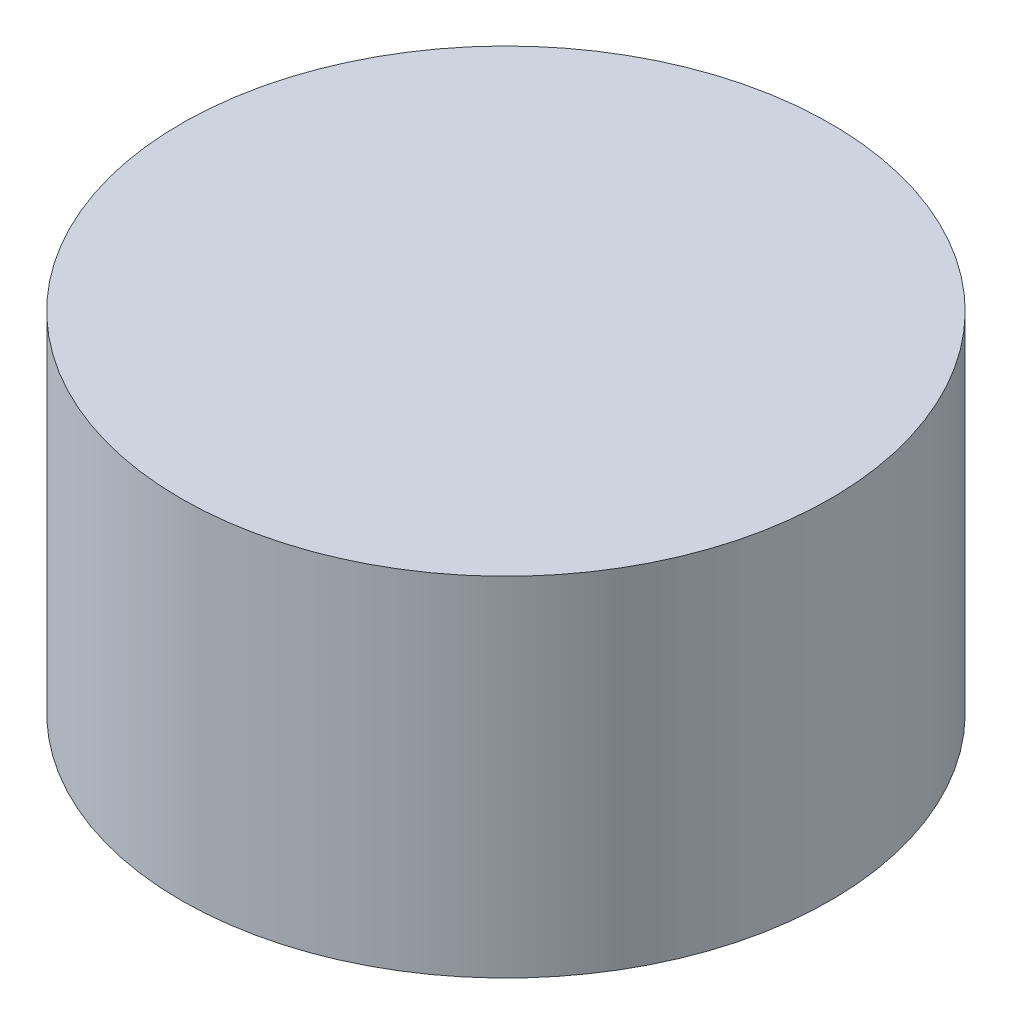
from build123d import *

# Parameters (mm, degrees)
SKETCH_1_R      = 5.6
EXTRUDE_1_DEPTH = 6


with BuildPart() as part:
    # 草图1 → 凸台-拉伸1 (new body)
    with BuildSketch(Plane(origin=(0, 0, 0), x_dir=(1, 0, 0), z_dir=(0, 1, 0))):
        Circle(SKETCH_1_R)
    extrude(amount=EXTRUDE_1_DEPTH)


solid = part.part
